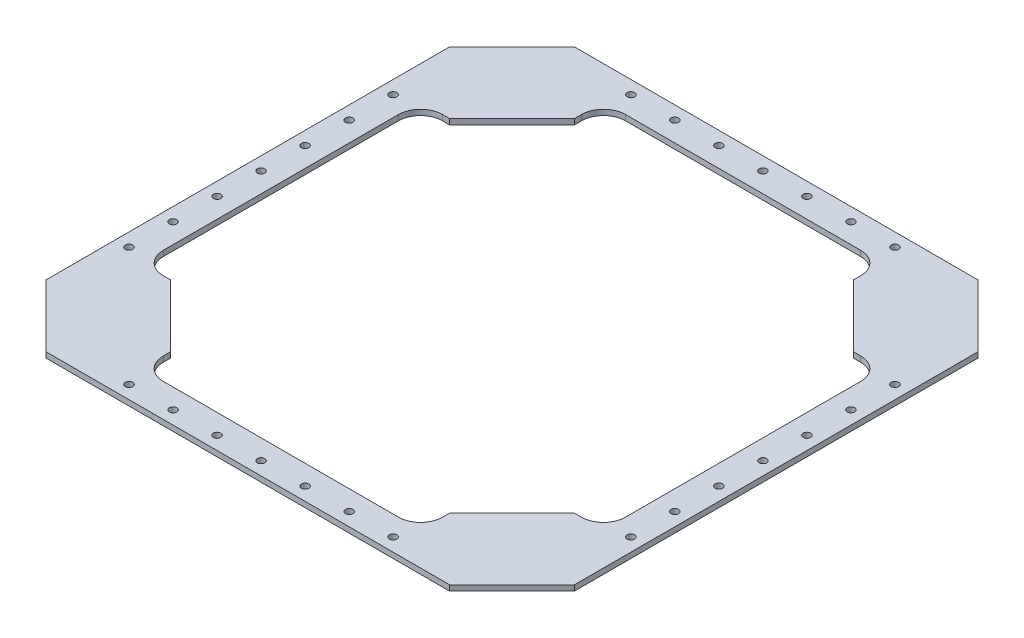
from build123d import *

# Parameters (mm, degrees)
BOSS_EXTRUDE1_DEPTH = 3.175
SKETCH3_R           = 2.159
CUT_EXTRUDE1_DEPTH  = 216.549531721
SKETCH4_R           = 2.159
CUT_EXTRUDE2_DEPTH  = 216.549531721


with BuildPart() as part:
    # Sketch2 → Boss-Extrude1 (new body)
    with BuildSketch(Plane(origin=(0, 0, 0), x_dir=(1, 0, 0), z_dir=(0, 1, 0))):
        Polygon((-152.4, 116.478975516), (-116.478975516, 152.4), (116.478975516, 152.4), (152.4, 116.478975516), (152.4, -116.478975516), (116.478975516, -152.4), (-116.478975516, -152.4), (-152.4, -116.478975516), align=None)
        with BuildLine():
            Line((-116.478975516, 80.557951031), (-80.557951031, 116.478975516))
            Line((-80.557951031, 116.478975516), (-80.557951031, 120.65))
            ThreePointArc((-80.557951031, 120.65), (-76.838207153, 129.630256121), (-67.857951031, 133.35))
            Line((-67.857951031, 133.35), (67.857951031, 133.35))
            ThreePointArc((67.857951031, 133.35), (76.838207153, 129.630256121), (80.557951031, 120.65))
            Line((80.557951031, 120.65), (80.557951031, 116.478975516))
            Line((80.557951031, 116.478975516), (116.478975516, 80.557951031))
            Line((116.478975516, 80.557951031), (120.65, 80.557951031))
            ThreePointArc((120.65, 80.557951031), (129.630256121, 76.838207153), (133.35, 67.857951031))
            Line((133.35, 67.857951031), (133.35, -67.857951031))
            ThreePointArc((133.35, -67.857951031), (129.630256121, -76.838207153), (120.65, -80.557951031))
            Line((120.65, -80.557951031), (116.478975516, -80.557951031))
            Line((116.478975516, -80.557951031), (80.557951031, -116.478975516))
            Line((80.557951031, -116.478975516), (80.557951031, -120.65))
            ThreePointArc((80.557951031, -120.65), (76.838207153, -129.630256121), (67.857951031, -133.35))
            Line((67.857951031, -133.35), (-67.857951031, -133.35))
            ThreePointArc((-67.857951031, -133.35), (-76.838207153, -129.630256121), (-80.557951031, -120.65))
            Line((-80.557951031, -120.65), (-80.557951031, -116.478975516))
            Line((-80.557951031, -116.478975516), (-116.478975516, -80.557951031))
            Line((-116.478975516, -80.557951031), (-120.65, -80.557951031))
            ThreePointArc((-120.65, -80.557951031), (-129.630256121, -76.838207153), (-133.35, -67.857951031))
            Line((-133.35, -67.857951031), (-133.35, 67.857951031))
            ThreePointArc((-133.35, 67.857951031), (-129.630256121, 76.838207153), (-120.65, 80.557951031))
            Line((-120.65, 80.557951031), (-116.478975516, 80.557951031))
        make_face(mode=Mode.SUBTRACT)
    extrude(amount=BOSS_EXTRUDE1_DEPTH)

    # Sketch3 → Cut-Extrude1 (cut, through all)
    with BuildSketch(Plane(origin=(0, 3.175, 0), x_dir=(1, 0, 0), z_dir=(0, 1, 0))):
        with Locations((-25.4, 144.78)):
            Circle(SKETCH3_R)
        with Locations((-76.2, 144.78)):
            Circle(SKETCH3_R)
        with Locations((-144.78, 76.2)):
            Circle(SKETCH3_R)
        with Locations((-144.78, 25.4)):
            Circle(SKETCH3_R)
        with Locations((144.78, 25.4)):
            Circle(SKETCH3_R)
        with Locations((144.78, 76.2)):
            Circle(SKETCH3_R)
        with Locations((25.4, 144.78)):
            Circle(SKETCH3_R)
        with Locations((76.2, 144.78)):
            Circle(SKETCH3_R)
        with Locations((76.2, -144.78)):
            Circle(SKETCH3_R)
        with Locations((25.4, -144.78)):
            Circle(SKETCH3_R)
        with Locations((144.78, -76.2)):
            Circle(SKETCH3_R)
        with Locations((144.78, -25.4)):
            Circle(SKETCH3_R)
        with Locations((-144.78, -25.4)):
            Circle(SKETCH3_R)
        with Locations((-144.78, -76.2)):
            Circle(SKETCH3_R)
        with Locations((-76.2, -144.78)):
            Circle(SKETCH3_R)
        with Locations((-25.4, -144.78)):
            Circle(SKETCH3_R)
    extrude(amount=-CUT_EXTRUDE1_DEPTH, mode=Mode.SUBTRACT)

    # Sketch4 → Cut-Extrude2 (cut, through all)
    with BuildSketch(Plane(origin=(0, 3.175, 0), x_dir=(1, 0, 0), z_dir=(0, 1, 0))):
        with Locations((0, 144.78)):
            Circle(SKETCH4_R)
        with Locations((-50.8, 144.78)):
            Circle(SKETCH4_R)
        with Locations((-144.78, 50.8)):
            Circle(SKETCH4_R)
        with Locations((-144.78, 0)):
            Circle(SKETCH4_R)
        with Locations((144.78, 0)):
            Circle(SKETCH4_R)
        with Locations((144.78, 50.8)):
            Circle(SKETCH4_R)
        with Locations((50.8, 144.78)):
            Circle(SKETCH4_R)
        with Locations((50.8, -144.78)):
            Circle(SKETCH4_R)
        with Locations((144.78, -50.8)):
            Circle(SKETCH4_R)
        with Locations((-50.8, -144.78)):
            Circle(SKETCH4_R)
        with Locations((0, -144.78)):
            Circle(SKETCH4_R)
        with Locations((-144.78, -50.8)):
            Circle(SKETCH4_R)
    extrude(amount=-CUT_EXTRUDE2_DEPTH, mode=Mode.SUBTRACT)


solid = part.part
